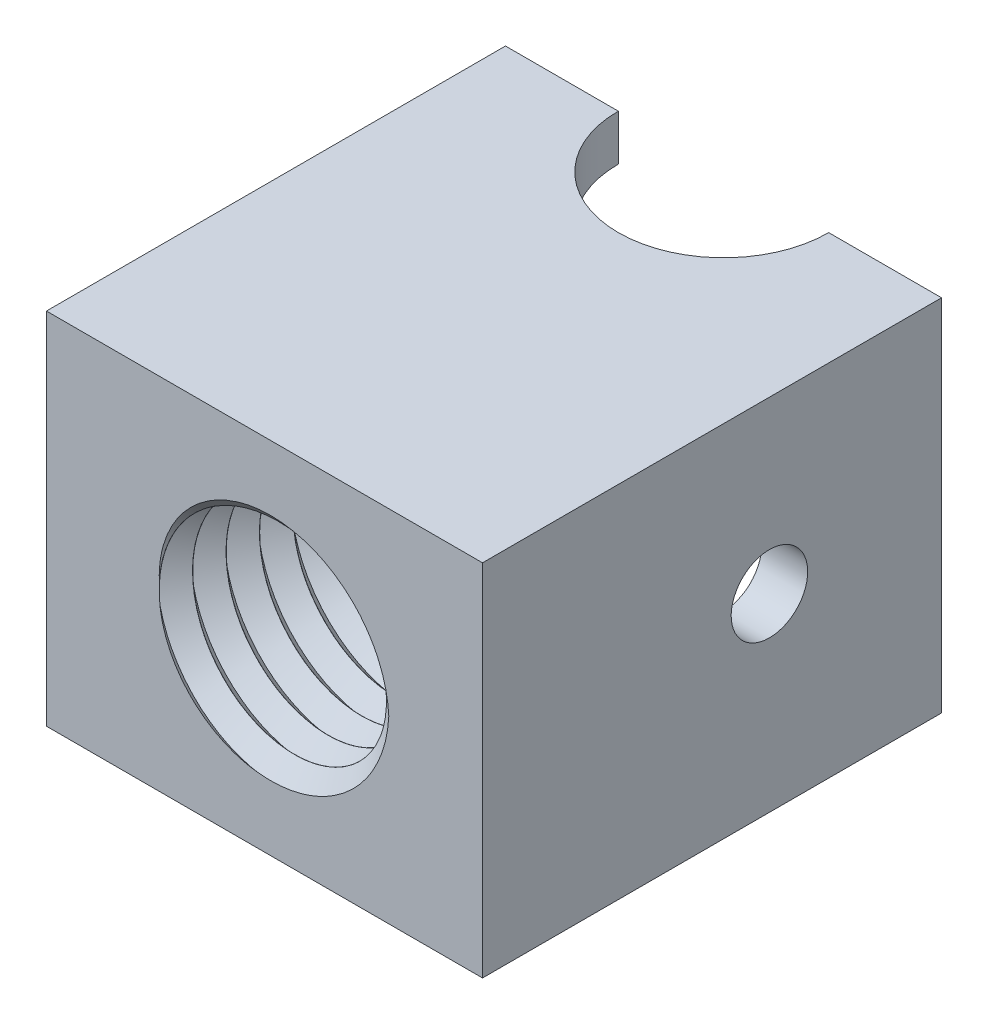
from build123d import *

# Parameters (mm, degrees)
SKETCH_1_W          = 22.8
SKETCH_1_H          = 18.8
SKETCH_1_W_2        = 18
SKETCH_1_H_2        = 14
EXTRUDE_1_DEPTH     = 12
SKETCH_1_3_W        = 22.8
SKETCH_1_3_H        = 18.8
SKETCH_1_3_W_2      = 18
SKETCH_1_3_H_2      = 14
SKETCH_1_3_R        = 5.5
EXTRUDE_2_DEPTH     = 12
SKETCH_2_R          = 5.5
CUT_EXTRUDE_1_DEPTH = 26.047954008
SKETCH_3_R          = 2
CUT_EXTRUDE_5_DEPTH = 28.426264784
SWEEP_1_PITCH       = 1.75


with BuildPart() as part:
    # 草图1 → 凸台-拉伸1 (new body)
    with BuildSketch(Plane.XY):
        Rectangle(SKETCH_1_W, SKETCH_1_H)
        Rectangle(SKETCH_1_W_2, SKETCH_1_H_2, mode=Mode.SUBTRACT)
    extrude(amount=-EXTRUDE_1_DEPTH)

    # 草图1<3> → 凸台-拉伸2 (add)
    # profile 1 of 2: a face of its own
    with BuildSketch(Plane.XY):
        Rectangle(SKETCH_1_3_W, SKETCH_1_3_H)
        Rectangle(SKETCH_1_3_W_2, SKETCH_1_3_H_2, mode=Mode.SUBTRACT)
    # profile 2 of 2: a face of its own
    with BuildSketch(Plane.XY):
        Rectangle(SKETCH_1_3_W_2, SKETCH_1_3_H_2)
        Circle(SKETCH_1_3_R, mode=Mode.SUBTRACT)
    extrude(amount=EXTRUDE_2_DEPTH)

    # 草图2 → 切除-拉伸1 (cut, through all)
    with BuildSketch(Plane(origin=(0, 9.4, 0), x_dir=(1, 0, 0), z_dir=(0, 1, 0))):
        with Locations((0, 12)):
            Circle(SKETCH_2_R)
    extrude(amount=-CUT_EXTRUDE_1_DEPTH, mode=Mode.SUBTRACT)

    # 草图3 → 切除-拉伸5 (cut, through all)
    with BuildSketch(Plane.ZY.offset(11.4)):
        with Locations(Location((-3, 0.5, 0), (0, 0, 270))):
            Circle(SKETCH_3_R)
    extrude(amount=-CUT_EXTRUDE_5_DEPTH, mode=Mode.SUBTRACT)

    # 切除-扫描1: arcs per turn and ends read off the stored shape
    # 切除-扫描1: the profile of 草图5 screwed along a right-hand helix through 8.5 turns, 10 arcs to a turn; built about Z, then put on its axis
    sweep_1_z = Axis((0, 0, 0), (0, 0, 1))
    sweep_1_corners = [(5.5, 0, -1.75), (5.5, 0, -0.88), (6.5, 0, -1.75), (5.5, 0, -2.62)]
    with BuildLine(mode=Mode.PRIVATE) as sweep_1_profile:
        Line(sweep_1_corners[0], sweep_1_corners[1])
        Line(sweep_1_corners[1], sweep_1_corners[2])
        Line(sweep_1_corners[2], sweep_1_corners[3])
        Line(sweep_1_corners[3], sweep_1_corners[0])
    sweep_1_cap = Face(sweep_1_profile.wire())
    sweep_1_turn_angles = [0, 18, 36, 54, 72, 90, 108, 126, 144, 162, 180, 198, 216, 234, 252, 270, 288, 306, 324, 342, 360]
    sweep_1_turn_weights = [1, 0.9510565162951535, 1, 0.9510565162951535, 1, 0.9510565162951535, 1, 0.9510565162951535, 1, 0.9510565162951535, 1, 0.9510565162951535, 1, 0.9510565162951535, 1, 0.9510565162951535, 1, 0.9510565162951535, 1, 0.9510565162951535, 1]
    sweep_1_turn_rails = [Edge.make_bspline([Vector(p[0], p[1], 0).rotate(sweep_1_z, sweep_1_turn_angles[k]) / sweep_1_turn_weights[k] + Vector(0, 0, p[2] + SWEEP_1_PITCH * sweep_1_turn_angles[k] / 360) for k in range(21)], [0, 0, 0, 1, 1, 2, 2, 3, 3, 4, 4, 5, 5, 6, 6, 7, 7, 8, 8, 9, 9, 10, 10, 10], 2, sweep_1_turn_weights) for p in sweep_1_corners]
    sweep_1_turn_sides = [Face.make_surface_from_curves(sweep_1_turn_rails[p[0]], sweep_1_turn_rails[p[1]]) for p in [(0, 1), (1, 2), (2, 3), (3, 0)]]
    sweep_1_last_angles = [2880, 2898, 2916, 2934, 2952, 2970, 2988, 3006, 3024, 3042, 3060]
    sweep_1_last_weights = [1, 0.9510565162951535, 1, 0.9510565162951535, 1, 0.9510565162951535, 1, 0.9510565162951535, 1, 0.9510565162951535, 1]
    sweep_1_last_rails = [Edge.make_bspline([Vector(p[0], p[1], 0).rotate(sweep_1_z, sweep_1_last_angles[k]) / sweep_1_last_weights[k] + Vector(0, 0, p[2] + SWEEP_1_PITCH * sweep_1_last_angles[k] / 360) for k in range(11)], [0, 0, 0, 1, 1, 2, 2, 3, 3, 4, 4, 5, 5, 5], 2, sweep_1_last_weights) for p in sweep_1_corners]
    sweep_1_last_sides = [Face.make_surface_from_curves(sweep_1_last_rails[p[0]], sweep_1_last_rails[p[1]]) for p in [(0, 1), (1, 2), (2, 3), (3, 0)]]
    sweep_1 = Plane(origin=(0, 0, 12), x_dir=(1, 0, 0), z_dir=(0, 0, -1)) * Solid(Shell([*[p.moved(Location((0, 0, SWEEP_1_PITCH * i))) for i in range(8) for p in sweep_1_turn_sides], *sweep_1_last_sides, sweep_1_cap, sweep_1_cap.rotate(sweep_1_z, 3060).moved(Location((0, 0, SWEEP_1_PITCH * 3060 / 360)))]))
    add(sweep_1, mode=Mode.SUBTRACT)


solid = part.part
